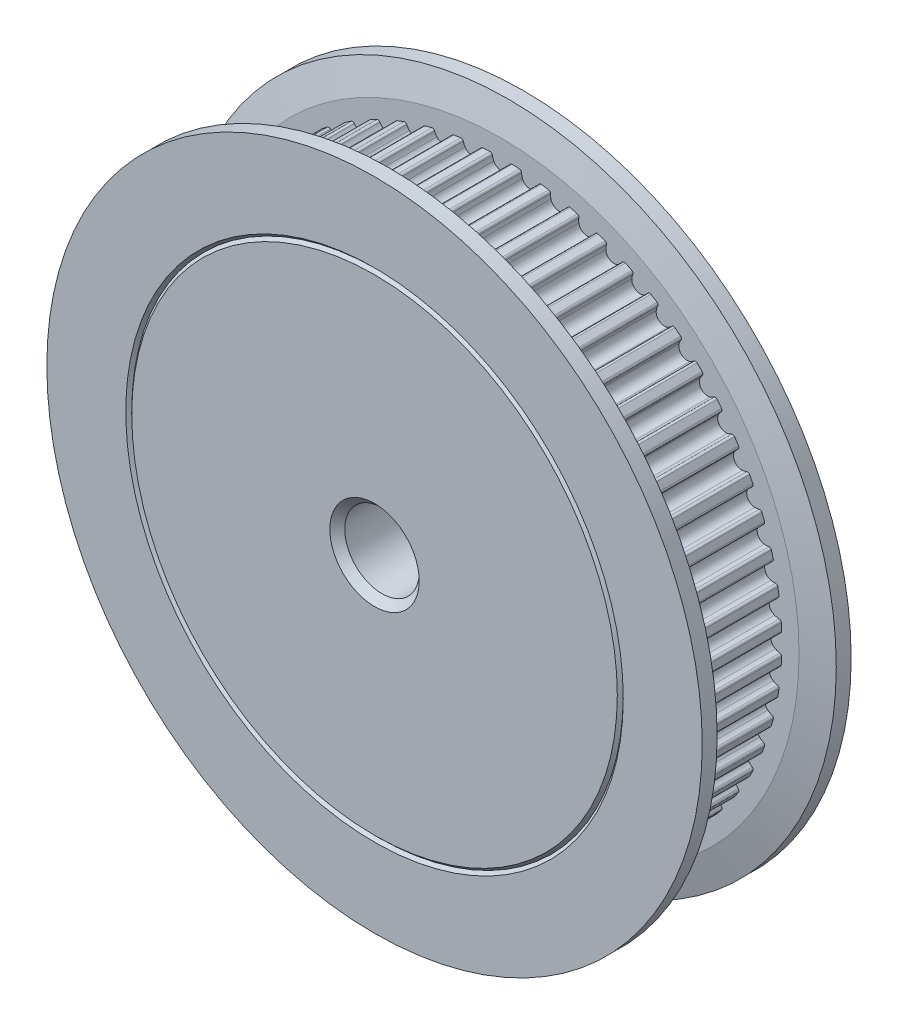
from build123d import *

# Parameters (mm, degrees)
CHAMFER_1_SIZE      = 0.5
CHAMFER_2_SIZE      = 2
CHAMFER_2_SIZE2     = 0.5
CHAMFER_3_SIZE      = 0.5
CHAMFER_3_SIZE2     = 2
CUT_EXTRUDE_START   = -1.5
CUT_EXTRUDE_4_DEPTH = 7
FILLET_1_R          = 0.15


with BuildPart() as part:
    # Эскиз2 → Повернуть1 (revolve)
    with BuildSketch(Plane(origin=(0, 0, 0), x_dir=(0, 0, -1), z_dir=(1, 0, 0)), mode=Mode.PRIVATE) as revolve_1_sk:
        Polygon((0, 16.3), (0, 2.5), (16, 2.5), (16, 12.5), (10, 12.5), (10, 16.3), (9.8, 16.5), (10, 16.7), (10, 22), (8.5, 22), (8.5, 18.85), (1.5, 18.85), (1.5, 22), (0, 22), (0, 16.7), (0.2, 16.5), align=None)
    revolve(revolve_1_sk.sketch.rotate(Axis((0, 0, 14.55226209), (0, 0, -1)), 90), axis=Axis((0, 0, 14.55226209), (0, 0, -1)))

    # Фаска1
    chamfer_1_edges = [part.edges().sort_by_distance(p)[0] for p in [
        (-12.5, 0, -10),
        (-12.5, 0, -16),
        (-2.5, 0, -16),
        (-2.5, 0, 0),
    ]]
    chamfer(chamfer_1_edges, length=CHAMFER_1_SIZE)

    # Фаска2
    chamfer_2_edges = [part.edges().sort_by_distance(p)[0] for p in [
        (-22, 0, -1.5),
    ]]
    chamfer_2_side = [part.faces().sort_by_distance(p)[0] for p in [
        (-19.472253967, 0, -1.5),
    ]]
    chamfer(chamfer_2_edges, length=CHAMFER_2_SIZE, length2=CHAMFER_2_SIZE2, reference=chamfer_2_side[0])

    # Фаска3
    chamfer_3_edges = [part.edges().sort_by_distance(p)[0] for p in [
        (-22, 0, -8.5),
    ]]
    chamfer_3_side = [part.faces().sort_by_distance(p)[0] for p in [
        (-22, 0, -9.25),
    ]]
    chamfer(chamfer_3_edges, length=CHAMFER_3_SIZE, length2=CHAMFER_3_SIZE2, reference=chamfer_3_side[0])

    # Эскиз3 → Вырез-Вытянуть4 (cut)
    with BuildSketch(Plane.XY.offset(CUT_EXTRUDE_START)):
        with BuildLine():
            ThreePointArc((-0.498876404, 18.411797753), (0, 18.1), (0.498876404, 18.411797753))
            ThreePointArc((0.498876404, 18.411797753), (0.573306366, 18.620490267), (0.599954397, 18.840449961))
            ThreePointArc((0.599954397, 18.840449961), (0, 18.85), (-0.599954397, 18.840449961))
            ThreePointArc((-0.599954397, 18.840449961), (-0.573306366, 18.620490267), (-0.498876404, 18.411797753))
        make_face()
        with BuildLine():
            ThreePointArc((1.372695497, 18.799952316), (1.970361533, 18.746737728), (2.566031066, 18.674527693))
            ThreePointArc((2.566031066, 18.674527693), (2.516536967, 18.458558439), (2.420700432, 18.258789214))
            ThreePointArc((2.420700432, 18.258789214), (1.891965185, 18.000846306), (1.428413418, 18.363082782))
            ThreePointArc((1.428413418, 18.363082782), (1.376205499, 18.578412106), (1.372695497, 18.799952316))
        make_face()
        with BuildLine():
            ThreePointArc((3.330305853, 18.553478459), (3.919135372, 18.438082274), (4.503993761, 18.304003393))
            ThreePointArc((4.503993761, 18.304003393), (4.432195862, 18.094390783), (4.31600276, 17.90573356))
            ThreePointArc((4.31600276, 17.90573356), (3.763201604, 17.704471573), (3.340053244, 18.113178034))
            ThreePointArc((3.340053244, 18.113178034), (3.310639369, 18.332784975), (3.330305853, 18.553478459))
        make_face()
        with BuildLine():
            ThreePointArc((5.25142868, 18.10372881), (5.824970344, 17.927415332), (6.392609759, 17.7329366))
            ThreePointArc((6.392609759, 17.7329366), (6.299294691, 17.531977195), (6.164018058, 17.356498942))
            ThreePointArc((6.164018058, 17.356498942), (5.593207598, 17.214122945), (5.215098747, 17.664821517))
            ThreePointArc((5.215098747, 17.664821517), (5.208801181, 17.886300015), (5.25142868, 18.10372881))
        make_face()
        with BuildLine():
            ThreePointArc((7.115015757, 17.455630919), (7.666985722, 17.220331877), (8.211186986, 16.967584044))
            ThreePointArc((8.211186986, 16.967584044), (8.09737713, 16.777479595), (7.944499084, 16.61710289))
            ThreePointArc((7.944499084, 16.61710289), (7.36193324, 16.535172783), (7.033006538, 17.022925518))
            ThreePointArc((7.033006538, 17.022925518), (7.049894277, 17.243849009), (7.115015757, 17.455630919))
        make_face()
        with BuildLine():
            ThreePointArc((8.900649231, 16.616285483), (9.425, 16.324578861), (9.93980073, 16.016331086))
            ThreePointArc((9.93980073, 16.016331086), (9.806743011, 15.839164419), (9.637938516, 15.695646381))
            ThreePointArc((9.637938516, 15.695646381), (9.05, 15.675059808), (8.773859237, 16.194522786))
            ThreePointArc((8.773859237, 16.194522786), (8.813747256, 16.412470785), (8.900649231, 16.616285483))
        make_face()
        with BuildLine():
            ThreePointArc((10.58876533, 15.594888547), (11.079752006, 15.249970344), (11.559511937, 14.889599853))
            ThreePointArc((11.559511937, 14.889599853), (11.408664162, 14.727312042), (11.225782677, 14.602225086))
            ThreePointArc((11.225782677, 14.602225086), (10.638913066, 14.643207598), (10.418583698, 15.188689472))
            ThreePointArc((10.418583698, 15.188689472), (10.481034976, 15.401274096), (10.58876533, 15.594888547))
        make_face()
        with BuildLine():
            ThreePointArc((12.1608687, 14.402630748), (12.61311193, 14.00827996), (13.052574712, 13.599735048))
            ThreePointArc((13.052574712, 13.599735048), (12.885589602, 13.454104153), (12.690634813, 13.348818757))
            ThreePointArc((12.690634813, 13.348818757), (12.111263975, 13.450921341), (11.949159976, 14.016445699))
            ThreePointArc((11.949159976, 14.016445699), (12.033490283, 14.221337826), (12.1608687, 14.402630748))
        make_face()
        with BuildLine():
            ThreePointArc((13.599735048, 13.052574712), (14.00827996, 12.61311193), (14.402630748, 12.1608687))
            ThreePointArc((14.402630748, 12.1608687), (14.221337826, 12.033490283), (14.016445699, 11.949159976))
            ThreePointArc((14.016445699, 11.949159976), (13.450921341, 12.111263975), (13.348818757, 12.690634813))
            ThreePointArc((13.348818757, 12.690634813), (13.454104153, 12.885589602), (13.599735048, 13.052574712))
        make_face()
        with BuildLine():
            ThreePointArc((14.889599853, 11.559511937), (15.249970344, 11.079752006), (15.594888547, 10.58876533))
            ThreePointArc((15.594888547, 10.58876533), (15.401274096, 10.481034976), (15.188689472, 10.418583698))
            ThreePointArc((15.188689472, 10.418583698), (14.643207598, 10.638913066), (14.602225086, 11.225782677))
            ThreePointArc((14.602225086, 11.225782677), (14.727312042, 11.408664162), (14.889599853, 11.559511937))
        make_face()
        with BuildLine():
            ThreePointArc((16.016331086, 9.93980073), (16.324578861, 9.425), (16.616285483, 8.900649231))
            ThreePointArc((16.616285483, 8.900649231), (16.412470785, 8.813747256), (16.194522786, 8.773859237))
            ThreePointArc((16.194522786, 8.773859237), (15.675059808, 9.05), (15.695646381, 9.637938516))
            ThreePointArc((15.695646381, 9.637938516), (15.839164419, 9.806743011), (16.016331086, 9.93980073))
        make_face()
        with BuildLine():
            ThreePointArc((16.967584044, 8.211186986), (17.220331877, 7.666985722), (17.455630919, 7.115015757))
            ThreePointArc((17.455630919, 7.115015757), (17.243849009, 7.049894277), (17.022925518, 7.033006538))
            ThreePointArc((17.022925518, 7.033006538), (16.535172783, 7.36193324), (16.61710289, 7.944499084))
            ThreePointArc((16.61710289, 7.944499084), (16.777479595, 8.09737713), (16.967584044, 8.211186986))
        make_face()
        with BuildLine():
            ThreePointArc((17.7329366, 6.392609759), (17.927415332, 5.824970344), (18.10372881, 5.25142868))
            ThreePointArc((18.10372881, 5.25142868), (17.886300015, 5.208801181), (17.664821517, 5.215098747))
            ThreePointArc((17.664821517, 5.215098747), (17.214122945, 5.593207598), (17.356498942, 6.164018058))
            ThreePointArc((17.356498942, 6.164018058), (17.531977195, 6.299294691), (17.7329366, 6.392609759))
        make_face()
        with BuildLine():
            ThreePointArc((18.304003393, 4.503993761), (18.438082274, 3.919135372), (18.553478459, 3.330305853))
            ThreePointArc((18.553478459, 3.330305853), (18.332784975, 3.310639369), (18.113178034, 3.340053244))
            ThreePointArc((18.113178034, 3.340053244), (17.704471573, 3.763201604), (17.90573356, 4.31600276))
            ThreePointArc((17.90573356, 4.31600276), (18.094390783, 4.432195862), (18.304003393, 4.503993761))
        make_face()
        with BuildLine():
            ThreePointArc((18.674527693, 2.566031066), (18.746737728, 1.970361533), (18.799952316, 1.372695497))
            ThreePointArc((18.799952316, 1.372695497), (18.578412106, 1.376205499), (18.363082782, 1.428413418))
            ThreePointArc((18.363082782, 1.428413418), (18.000846306, 1.891965185), (18.258789214, 2.420700432))
            ThreePointArc((18.258789214, 2.420700432), (18.458558439, 2.516536967), (18.674527693, 2.566031066))
        make_face()
        with BuildLine():
            ThreePointArc((18.840449961, 0.599954397), (18.85, 0), (18.840449961, -0.599954397))
            ThreePointArc((18.840449961, -0.599954397), (18.620490267, -0.573306366), (18.411797753, -0.498876404))
            ThreePointArc((18.411797753, -0.498876404), (18.1, 0), (18.411797753, 0.498876404))
            ThreePointArc((18.411797753, 0.498876404), (18.620490267, 0.573306366), (18.840449961, 0.599954397))
        make_face()
        with BuildLine():
            ThreePointArc((18.799952316, -1.372695497), (18.746737728, -1.970361533), (18.674527693, -2.566031066))
            ThreePointArc((18.674527693, -2.566031066), (18.458558439, -2.516536967), (18.258789214, -2.420700432))
            ThreePointArc((18.258789214, -2.420700432), (18.000846306, -1.891965185), (18.363082782, -1.428413418))
            ThreePointArc((18.363082782, -1.428413418), (18.578412106, -1.376205499), (18.799952316, -1.372695497))
        make_face()
        with BuildLine():
            ThreePointArc((18.553478459, -3.330305853), (18.438082274, -3.919135372), (18.304003393, -4.503993761))
            ThreePointArc((18.304003393, -4.503993761), (18.094390783, -4.432195862), (17.90573356, -4.31600276))
            ThreePointArc((17.90573356, -4.31600276), (17.704471573, -3.763201604), (18.113178034, -3.340053244))
            ThreePointArc((18.113178034, -3.340053244), (18.332784975, -3.310639369), (18.553478459, -3.330305853))
        make_face()
        with BuildLine():
            ThreePointArc((18.10372881, -5.25142868), (17.927415332, -5.824970344), (17.7329366, -6.392609759))
            ThreePointArc((17.7329366, -6.392609759), (17.531977195, -6.299294691), (17.356498942, -6.164018058))
            ThreePointArc((17.356498942, -6.164018058), (17.214122945, -5.593207598), (17.664821517, -5.215098747))
            ThreePointArc((17.664821517, -5.215098747), (17.886300015, -5.208801181), (18.10372881, -5.25142868))
        make_face()
        with BuildLine():
            ThreePointArc((17.455630919, -7.115015757), (17.220331877, -7.666985722), (16.967584044, -8.211186986))
            ThreePointArc((16.967584044, -8.211186986), (16.777479595, -8.09737713), (16.61710289, -7.944499084))
            ThreePointArc((16.61710289, -7.944499084), (16.535172783, -7.36193324), (17.022925518, -7.033006538))
            ThreePointArc((17.022925518, -7.033006538), (17.243849009, -7.049894277), (17.455630919, -7.115015757))
        make_face()
        with BuildLine():
            ThreePointArc((16.616285483, -8.900649231), (16.324578861, -9.425), (16.016331086, -9.93980073))
            ThreePointArc((16.016331086, -9.93980073), (15.839164419, -9.806743011), (15.695646381, -9.637938516))
            ThreePointArc((15.695646381, -9.637938516), (15.675059808, -9.05), (16.194522786, -8.773859237))
            ThreePointArc((16.194522786, -8.773859237), (16.412470785, -8.813747256), (16.616285483, -8.900649231))
        make_face()
        with BuildLine():
            ThreePointArc((15.594888547, -10.58876533), (15.249970344, -11.079752006), (14.889599853, -11.559511937))
            ThreePointArc((14.889599853, -11.559511937), (14.727312042, -11.408664162), (14.602225086, -11.225782677))
            ThreePointArc((14.602225086, -11.225782677), (14.643207598, -10.638913066), (15.188689472, -10.418583698))
            ThreePointArc((15.188689472, -10.418583698), (15.401274096, -10.481034976), (15.594888547, -10.58876533))
        make_face()
        with BuildLine():
            ThreePointArc((14.402630748, -12.1608687), (14.00827996, -12.61311193), (13.599735048, -13.052574712))
            ThreePointArc((13.599735048, -13.052574712), (13.454104153, -12.885589602), (13.348818757, -12.690634813))
            ThreePointArc((13.348818757, -12.690634813), (13.450921341, -12.111263975), (14.016445699, -11.949159976))
            ThreePointArc((14.016445699, -11.949159976), (14.221337826, -12.033490283), (14.402630748, -12.1608687))
        make_face()
        with BuildLine():
            ThreePointArc((13.052574712, -13.599735048), (12.61311193, -14.00827996), (12.1608687, -14.402630748))
            ThreePointArc((12.1608687, -14.402630748), (12.033490283, -14.221337826), (11.949159976, -14.016445699))
            ThreePointArc((11.949159976, -14.016445699), (12.111263975, -13.450921341), (12.690634813, -13.348818757))
            ThreePointArc((12.690634813, -13.348818757), (12.885589602, -13.454104153), (13.052574712, -13.599735048))
        make_face()
        with BuildLine():
            ThreePointArc((11.559511937, -14.889599853), (11.079752006, -15.249970344), (10.58876533, -15.594888547))
            ThreePointArc((10.58876533, -15.594888547), (10.481034976, -15.401274096), (10.418583698, -15.188689472))
            ThreePointArc((10.418583698, -15.188689472), (10.638913066, -14.643207598), (11.225782677, -14.602225086))
            ThreePointArc((11.225782677, -14.602225086), (11.408664162, -14.727312042), (11.559511937, -14.889599853))
        make_face()
        with BuildLine():
            ThreePointArc((9.93980073, -16.016331086), (9.425, -16.324578861), (8.900649231, -16.616285483))
            ThreePointArc((8.900649231, -16.616285483), (8.813747256, -16.412470785), (8.773859237, -16.194522786))
            ThreePointArc((8.773859237, -16.194522786), (9.05, -15.675059808), (9.637938516, -15.695646381))
            ThreePointArc((9.637938516, -15.695646381), (9.806743011, -15.839164419), (9.93980073, -16.016331086))
        make_face()
        with BuildLine():
            ThreePointArc((8.211186986, -16.967584044), (7.666985722, -17.220331877), (7.115015757, -17.455630919))
            ThreePointArc((7.115015757, -17.455630919), (7.049894277, -17.243849009), (7.033006538, -17.022925518))
            ThreePointArc((7.033006538, -17.022925518), (7.36193324, -16.535172783), (7.944499084, -16.61710289))
            ThreePointArc((7.944499084, -16.61710289), (8.09737713, -16.777479595), (8.211186986, -16.967584044))
        make_face()
        with BuildLine():
            ThreePointArc((6.392609759, -17.7329366), (5.824970344, -17.927415332), (5.25142868, -18.10372881))
            ThreePointArc((5.25142868, -18.10372881), (5.208801181, -17.886300015), (5.215098747, -17.664821517))
            ThreePointArc((5.215098747, -17.664821517), (5.593207598, -17.214122945), (6.164018058, -17.356498942))
            ThreePointArc((6.164018058, -17.356498942), (6.299294691, -17.531977195), (6.392609759, -17.7329366))
        make_face()
        with BuildLine():
            ThreePointArc((4.503993761, -18.304003393), (3.919135372, -18.438082274), (3.330305853, -18.553478459))
            ThreePointArc((3.330305853, -18.553478459), (3.310639369, -18.332784975), (3.340053244, -18.113178034))
            ThreePointArc((3.340053244, -18.113178034), (3.763201604, -17.704471573), (4.31600276, -17.90573356))
            ThreePointArc((4.31600276, -17.90573356), (4.432195862, -18.094390783), (4.503993761, -18.304003393))
        make_face()
        with BuildLine():
            ThreePointArc((2.566031066, -18.674527693), (1.970361533, -18.746737728), (1.372695497, -18.799952316))
            ThreePointArc((1.372695497, -18.799952316), (1.376205499, -18.578412106), (1.428413418, -18.363082782))
            ThreePointArc((1.428413418, -18.363082782), (1.891965185, -18.000846306), (2.420700432, -18.258789214))
            ThreePointArc((2.420700432, -18.258789214), (2.516536967, -18.458558439), (2.566031066, -18.674527693))
        make_face()
        with BuildLine():
            ThreePointArc((0.599954397, -18.840449961), (0, -18.85), (-0.599954397, -18.840449961))
            ThreePointArc((-0.599954397, -18.840449961), (-0.573306366, -18.620490267), (-0.498876404, -18.411797753))
            ThreePointArc((-0.498876404, -18.411797753), (0, -18.1), (0.498876404, -18.411797753))
            ThreePointArc((0.498876404, -18.411797753), (0.573306366, -18.620490267), (0.599954397, -18.840449961))
        make_face()
        with BuildLine():
            ThreePointArc((-1.372695497, -18.799952316), (-1.970361533, -18.746737728), (-2.566031066, -18.674527693))
            ThreePointArc((-2.566031066, -18.674527693), (-2.516536967, -18.458558439), (-2.420700432, -18.258789214))
            ThreePointArc((-2.420700432, -18.258789214), (-1.891965185, -18.000846306), (-1.428413418, -18.363082782))
            ThreePointArc((-1.428413418, -18.363082782), (-1.376205499, -18.578412106), (-1.372695497, -18.799952316))
        make_face()
        with BuildLine():
            ThreePointArc((-3.330305853, -18.553478459), (-3.919135372, -18.438082274), (-4.503993761, -18.304003393))
            ThreePointArc((-4.503993761, -18.304003393), (-4.432195862, -18.094390783), (-4.31600276, -17.90573356))
            ThreePointArc((-4.31600276, -17.90573356), (-3.763201604, -17.704471573), (-3.340053244, -18.113178034))
            ThreePointArc((-3.340053244, -18.113178034), (-3.310639369, -18.332784975), (-3.330305853, -18.553478459))
        make_face()
        with BuildLine():
            ThreePointArc((-5.25142868, -18.10372881), (-5.824970344, -17.927415332), (-6.392609759, -17.7329366))
            ThreePointArc((-6.392609759, -17.7329366), (-6.299294691, -17.531977195), (-6.164018058, -17.356498942))
            ThreePointArc((-6.164018058, -17.356498942), (-5.593207598, -17.214122945), (-5.215098747, -17.664821517))
            ThreePointArc((-5.215098747, -17.664821517), (-5.208801181, -17.886300015), (-5.25142868, -18.10372881))
        make_face()
        with BuildLine():
            ThreePointArc((-7.115015757, -17.455630919), (-7.666985722, -17.220331877), (-8.211186986, -16.967584044))
            ThreePointArc((-8.211186986, -16.967584044), (-8.09737713, -16.777479595), (-7.944499084, -16.61710289))
            ThreePointArc((-7.944499084, -16.61710289), (-7.36193324, -16.535172783), (-7.033006538, -17.022925518))
            ThreePointArc((-7.033006538, -17.022925518), (-7.049894277, -17.243849009), (-7.115015757, -17.455630919))
        make_face()
        with BuildLine():
            ThreePointArc((-8.900649231, -16.616285483), (-9.425, -16.324578861), (-9.93980073, -16.016331086))
            ThreePointArc((-9.93980073, -16.016331086), (-9.806743011, -15.839164419), (-9.637938516, -15.695646381))
            ThreePointArc((-9.637938516, -15.695646381), (-9.05, -15.675059808), (-8.773859237, -16.194522786))
            ThreePointArc((-8.773859237, -16.194522786), (-8.813747256, -16.412470785), (-8.900649231, -16.616285483))
        make_face()
        with BuildLine():
            ThreePointArc((-10.58876533, -15.594888547), (-11.079752006, -15.249970344), (-11.559511937, -14.889599853))
            ThreePointArc((-11.559511937, -14.889599853), (-11.408664162, -14.727312042), (-11.225782677, -14.602225086))
            ThreePointArc((-11.225782677, -14.602225086), (-10.638913066, -14.643207598), (-10.418583698, -15.188689472))
            ThreePointArc((-10.418583698, -15.188689472), (-10.481034976, -15.401274096), (-10.58876533, -15.594888547))
        make_face()
        with BuildLine():
            ThreePointArc((-12.1608687, -14.402630748), (-12.61311193, -14.00827996), (-13.052574712, -13.599735048))
            ThreePointArc((-13.052574712, -13.599735048), (-12.885589602, -13.454104153), (-12.690634813, -13.348818757))
            ThreePointArc((-12.690634813, -13.348818757), (-12.111263975, -13.450921341), (-11.949159976, -14.016445699))
            ThreePointArc((-11.949159976, -14.016445699), (-12.033490283, -14.221337826), (-12.1608687, -14.402630748))
        make_face()
        with BuildLine():
            ThreePointArc((-13.599735048, -13.052574712), (-14.00827996, -12.61311193), (-14.402630748, -12.1608687))
            ThreePointArc((-14.402630748, -12.1608687), (-14.221337826, -12.033490283), (-14.016445699, -11.949159976))
            ThreePointArc((-14.016445699, -11.949159976), (-13.450921341, -12.111263975), (-13.348818757, -12.690634813))
            ThreePointArc((-13.348818757, -12.690634813), (-13.454104153, -12.885589602), (-13.599735048, -13.052574712))
        make_face()
        with BuildLine():
            ThreePointArc((-14.889599853, -11.559511937), (-15.249970344, -11.079752006), (-15.594888547, -10.58876533))
            ThreePointArc((-15.594888547, -10.58876533), (-15.401274096, -10.481034976), (-15.188689472, -10.418583698))
            ThreePointArc((-15.188689472, -10.418583698), (-14.643207598, -10.638913066), (-14.602225086, -11.225782677))
            ThreePointArc((-14.602225086, -11.225782677), (-14.727312042, -11.408664162), (-14.889599853, -11.559511937))
        make_face()
        with BuildLine():
            ThreePointArc((-16.016331086, -9.93980073), (-16.324578861, -9.425), (-16.616285483, -8.900649231))
            ThreePointArc((-16.616285483, -8.900649231), (-16.412470785, -8.813747256), (-16.194522786, -8.773859237))
            ThreePointArc((-16.194522786, -8.773859237), (-15.675059808, -9.05), (-15.695646381, -9.637938516))
            ThreePointArc((-15.695646381, -9.637938516), (-15.839164419, -9.806743011), (-16.016331086, -9.93980073))
        make_face()
        with BuildLine():
            ThreePointArc((-16.967584044, -8.211186986), (-17.220331877, -7.666985722), (-17.455630919, -7.115015757))
            ThreePointArc((-17.455630919, -7.115015757), (-17.243849009, -7.049894277), (-17.022925518, -7.033006538))
            ThreePointArc((-17.022925518, -7.033006538), (-16.535172783, -7.36193324), (-16.61710289, -7.944499084))
            ThreePointArc((-16.61710289, -7.944499084), (-16.777479595, -8.09737713), (-16.967584044, -8.211186986))
        make_face()
        with BuildLine():
            ThreePointArc((-17.7329366, -6.392609759), (-17.927415332, -5.824970344), (-18.10372881, -5.25142868))
            ThreePointArc((-18.10372881, -5.25142868), (-17.886300015, -5.208801181), (-17.664821517, -5.215098747))
            ThreePointArc((-17.664821517, -5.215098747), (-17.214122945, -5.593207598), (-17.356498942, -6.164018058))
            ThreePointArc((-17.356498942, -6.164018058), (-17.531977195, -6.299294691), (-17.7329366, -6.392609759))
        make_face()
        with BuildLine():
            ThreePointArc((-18.304003393, -4.503993761), (-18.438082274, -3.919135372), (-18.553478459, -3.330305853))
            ThreePointArc((-18.553478459, -3.330305853), (-18.332784975, -3.310639369), (-18.113178034, -3.340053244))
            ThreePointArc((-18.113178034, -3.340053244), (-17.704471573, -3.763201604), (-17.90573356, -4.31600276))
            ThreePointArc((-17.90573356, -4.31600276), (-18.094390783, -4.432195862), (-18.304003393, -4.503993761))
        make_face()
        with BuildLine():
            ThreePointArc((-18.674527693, -2.566031066), (-18.746737728, -1.970361533), (-18.799952316, -1.372695497))
            ThreePointArc((-18.799952316, -1.372695497), (-18.578412106, -1.376205499), (-18.363082782, -1.428413418))
            ThreePointArc((-18.363082782, -1.428413418), (-18.000846306, -1.891965185), (-18.258789214, -2.420700432))
            ThreePointArc((-18.258789214, -2.420700432), (-18.458558439, -2.516536967), (-18.674527693, -2.566031066))
        make_face()
        with BuildLine():
            ThreePointArc((-18.840449961, -0.599954397), (-18.85, 0), (-18.840449961, 0.599954397))
            ThreePointArc((-18.840449961, 0.599954397), (-18.620490267, 0.573306366), (-18.411797753, 0.498876404))
            ThreePointArc((-18.411797753, 0.498876404), (-18.1, 0), (-18.411797753, -0.498876404))
            ThreePointArc((-18.411797753, -0.498876404), (-18.620490267, -0.573306366), (-18.840449961, -0.599954397))
        make_face()
        with BuildLine():
            ThreePointArc((-18.799952316, 1.372695497), (-18.746737728, 1.970361533), (-18.674527693, 2.566031066))
            ThreePointArc((-18.674527693, 2.566031066), (-18.458558439, 2.516536967), (-18.258789214, 2.420700432))
            ThreePointArc((-18.258789214, 2.420700432), (-18.000846306, 1.891965185), (-18.363082782, 1.428413418))
            ThreePointArc((-18.363082782, 1.428413418), (-18.578412106, 1.376205499), (-18.799952316, 1.372695497))
        make_face()
        with BuildLine():
            ThreePointArc((-18.553478459, 3.330305853), (-18.438082274, 3.919135372), (-18.304003393, 4.503993761))
            ThreePointArc((-18.304003393, 4.503993761), (-18.094390783, 4.432195862), (-17.90573356, 4.31600276))
            ThreePointArc((-17.90573356, 4.31600276), (-17.704471573, 3.763201604), (-18.113178034, 3.340053244))
            ThreePointArc((-18.113178034, 3.340053244), (-18.332784975, 3.310639369), (-18.553478459, 3.330305853))
        make_face()
        with BuildLine():
            ThreePointArc((-18.10372881, 5.25142868), (-17.927415332, 5.824970344), (-17.7329366, 6.392609759))
            ThreePointArc((-17.7329366, 6.392609759), (-17.531977195, 6.299294691), (-17.356498942, 6.164018058))
            ThreePointArc((-17.356498942, 6.164018058), (-17.214122945, 5.593207598), (-17.664821517, 5.215098747))
            ThreePointArc((-17.664821517, 5.215098747), (-17.886300015, 5.208801181), (-18.10372881, 5.25142868))
        make_face()
        with BuildLine():
            ThreePointArc((-17.455630919, 7.115015757), (-17.220331877, 7.666985722), (-16.967584044, 8.211186986))
            ThreePointArc((-16.967584044, 8.211186986), (-16.777479595, 8.09737713), (-16.61710289, 7.944499084))
            ThreePointArc((-16.61710289, 7.944499084), (-16.535172783, 7.36193324), (-17.022925518, 7.033006538))
            ThreePointArc((-17.022925518, 7.033006538), (-17.243849009, 7.049894277), (-17.455630919, 7.115015757))
        make_face()
        with BuildLine():
            ThreePointArc((-16.616285483, 8.900649231), (-16.324578861, 9.425), (-16.016331086, 9.93980073))
            ThreePointArc((-16.016331086, 9.93980073), (-15.839164419, 9.806743011), (-15.695646381, 9.637938516))
            ThreePointArc((-15.695646381, 9.637938516), (-15.675059808, 9.05), (-16.194522786, 8.773859237))
            ThreePointArc((-16.194522786, 8.773859237), (-16.412470785, 8.813747256), (-16.616285483, 8.900649231))
        make_face()
        with BuildLine():
            ThreePointArc((-15.594888547, 10.58876533), (-15.249970344, 11.079752006), (-14.889599853, 11.559511937))
            ThreePointArc((-14.889599853, 11.559511937), (-14.727312042, 11.408664162), (-14.602225086, 11.225782677))
            ThreePointArc((-14.602225086, 11.225782677), (-14.643207598, 10.638913066), (-15.188689472, 10.418583698))
            ThreePointArc((-15.188689472, 10.418583698), (-15.401274096, 10.481034976), (-15.594888547, 10.58876533))
        make_face()
        with BuildLine():
            ThreePointArc((-14.402630748, 12.1608687), (-14.00827996, 12.61311193), (-13.599735048, 13.052574712))
            ThreePointArc((-13.599735048, 13.052574712), (-13.454104153, 12.885589602), (-13.348818757, 12.690634813))
            ThreePointArc((-13.348818757, 12.690634813), (-13.450921341, 12.111263975), (-14.016445699, 11.949159976))
            ThreePointArc((-14.016445699, 11.949159976), (-14.221337826, 12.033490283), (-14.402630748, 12.1608687))
        make_face()
        with BuildLine():
            ThreePointArc((-13.052574712, 13.599735048), (-12.61311193, 14.00827996), (-12.1608687, 14.402630748))
            ThreePointArc((-12.1608687, 14.402630748), (-12.033490283, 14.221337826), (-11.949159976, 14.016445699))
            ThreePointArc((-11.949159976, 14.016445699), (-12.111263975, 13.450921341), (-12.690634813, 13.348818757))
            ThreePointArc((-12.690634813, 13.348818757), (-12.885589602, 13.454104153), (-13.052574712, 13.599735048))
        make_face()
        with BuildLine():
            ThreePointArc((-11.559511937, 14.889599853), (-11.079752006, 15.249970344), (-10.58876533, 15.594888547))
            ThreePointArc((-10.58876533, 15.594888547), (-10.481034976, 15.401274096), (-10.418583698, 15.188689472))
            ThreePointArc((-10.418583698, 15.188689472), (-10.638913066, 14.643207598), (-11.225782677, 14.602225086))
            ThreePointArc((-11.225782677, 14.602225086), (-11.408664162, 14.727312042), (-11.559511937, 14.889599853))
        make_face()
        with BuildLine():
            ThreePointArc((-9.93980073, 16.016331086), (-9.425, 16.324578861), (-8.900649231, 16.616285483))
            ThreePointArc((-8.900649231, 16.616285483), (-8.813747256, 16.412470785), (-8.773859237, 16.194522786))
            ThreePointArc((-8.773859237, 16.194522786), (-9.05, 15.675059808), (-9.637938516, 15.695646381))
            ThreePointArc((-9.637938516, 15.695646381), (-9.806743011, 15.839164419), (-9.93980073, 16.016331086))
        make_face()
        with BuildLine():
            ThreePointArc((-8.211186986, 16.967584044), (-7.666985722, 17.220331877), (-7.115015757, 17.455630919))
            ThreePointArc((-7.115015757, 17.455630919), (-7.049894277, 17.243849009), (-7.033006538, 17.022925518))
            ThreePointArc((-7.033006538, 17.022925518), (-7.36193324, 16.535172783), (-7.944499084, 16.61710289))
            ThreePointArc((-7.944499084, 16.61710289), (-8.09737713, 16.777479595), (-8.211186986, 16.967584044))
        make_face()
        with BuildLine():
            ThreePointArc((-6.392609759, 17.7329366), (-5.824970344, 17.927415332), (-5.25142868, 18.10372881))
            ThreePointArc((-5.25142868, 18.10372881), (-5.208801181, 17.886300015), (-5.215098747, 17.664821517))
            ThreePointArc((-5.215098747, 17.664821517), (-5.593207598, 17.214122945), (-6.164018058, 17.356498942))
            ThreePointArc((-6.164018058, 17.356498942), (-6.299294691, 17.531977195), (-6.392609759, 17.7329366))
        make_face()
        with BuildLine():
            ThreePointArc((-4.503993761, 18.304003393), (-3.919135372, 18.438082274), (-3.330305853, 18.553478459))
            ThreePointArc((-3.330305853, 18.553478459), (-3.310639369, 18.332784975), (-3.340053244, 18.113178034))
            ThreePointArc((-3.340053244, 18.113178034), (-3.763201604, 17.704471573), (-4.31600276, 17.90573356))
            ThreePointArc((-4.31600276, 17.90573356), (-4.432195862, 18.094390783), (-4.503993761, 18.304003393))
        make_face()
        with BuildLine():
            ThreePointArc((-2.566031066, 18.674527693), (-1.970361533, 18.746737728), (-1.372695497, 18.799952316))
            ThreePointArc((-1.372695497, 18.799952316), (-1.376205499, 18.578412106), (-1.428413418, 18.363082782))
            ThreePointArc((-1.428413418, 18.363082782), (-1.891965185, 18.000846306), (-2.420700432, 18.258789214))
            ThreePointArc((-2.420700432, 18.258789214), (-2.516536967, 18.458558439), (-2.566031066, 18.674527693))
        make_face()
    extrude(amount=-CUT_EXTRUDE_4_DEPTH, mode=Mode.SUBTRACT)

    # Скругление1
    fillet_1_edges = [part.edges().sort_by_distance(p)[0] for p in [
        (7.115015757, 17.455630919, -5),
        (8.211186986, 16.967584044, -5),
        (8.900649231, 16.616285483, -5),
        (9.93980073, 16.016331086, -5),
        (10.58876533, 15.594888547, -5),
        (11.559511937, 14.889599853, -5),
        (12.1608687, 14.402630748, -5),
        (13.052574712, 13.599735048, -5),
        (13.599735048, 13.052574712, -5),
        (14.402630748, 12.1608687, -5),
        (14.889599853, 11.559511937, -5),
        (15.594888547, 10.58876533, -5),
        (16.016331086, 9.93980073, -5),
        (16.616285483, 8.900649231, -5),
        (16.967584044, 8.211186986, -5),
        (17.455630919, 7.115015757, -5),
        (17.7329366, 6.392609759, -5),
        (18.10372881, 5.25142868, -5),
        (18.304003393, 4.503993761, -5),
        (18.553478459, 3.330305853, -5),
        (18.674527693, 2.566031066, -5),
        (18.799952316, 1.372695497, -5),
        (18.840449961, 0.599954397, -5),
        (18.840449961, -0.599954397, -5),
        (18.799952316, -1.372695497, -5),
        (18.674527693, -2.566031066, -5),
        (18.553478459, -3.330305853, -5),
        (18.304003393, -4.503993761, -5),
        (18.10372881, -5.25142868, -5),
        (17.7329366, -6.392609759, -5),
        (17.455630919, -7.115015757, -5),
        (16.967584044, -8.211186986, -5),
        (16.616285483, -8.900649231, -5),
        (16.016331086, -9.93980073, -5),
        (15.594888547, -10.58876533, -5),
        (14.889599853, -11.559511937, -5),
        (14.402630748, -12.1608687, -5),
        (13.599735048, -13.052574712, -5),
        (13.052574712, -13.599735048, -5),
        (12.1608687, -14.402630748, -5),
        (11.559511937, -14.889599853, -5),
        (10.58876533, -15.594888547, -5),
        (9.93980073, -16.016331086, -5),
        (8.900649231, -16.616285483, -5),
        (8.211186986, -16.967584044, -5),
        (7.115015757, -17.455630919, -5),
        (6.392609759, -17.7329366, -5),
        (5.25142868, -18.10372881, -5),
        (4.503993761, -18.304003393, -5),
        (3.330305853, -18.553478459, -5),
        (2.566031066, -18.674527693, -5),
        (1.372695497, -18.799952316, -5),
        (0.599954397, -18.840449961, -5),
        (-0.599954397, -18.840449961, -5),
        (-1.372695497, -18.799952316, -5),
        (-2.566031066, -18.674527693, -5),
        (-3.330305853, -18.553478459, -5),
        (-4.503993761, -18.304003393, -5),
        (-5.25142868, -18.10372881, -5),
        (-6.392609759, -17.7329366, -5),
        (-7.115015757, -17.455630919, -5),
        (-8.211186986, -16.967584044, -5),
        (-8.900649231, -16.616285483, -5),
        (-9.93980073, -16.016331086, -5),
        (-10.58876533, -15.594888547, -5),
        (-11.559511937, -14.889599853, -5),
        (-12.1608687, -14.402630748, -5),
        (-13.052574712, -13.599735048, -5),
        (-13.599735048, -13.052574712, -5),
        (-14.402630748, -12.1608687, -5),
        (-14.889599853, -11.559511937, -5),
        (-15.594888547, -10.58876533, -5),
        (-16.016331086, -9.93980073, -5),
        (-16.616285483, -8.900649231, -5),
        (-16.967584044, -8.211186986, -5),
        (-17.455630919, -7.115015757, -5),
        (-17.7329366, -6.392609759, -5),
        (-18.10372881, -5.25142868, -5),
        (-18.304003393, -4.503993761, -5),
        (-18.553478459, -3.330305853, -5),
        (-18.674527693, -2.566031066, -5),
        (-18.799952316, -1.372695497, -5),
        (-18.840449961, -0.599954397, -5),
        (-18.840449961, 0.599954397, -5),
        (-18.799952316, 1.372695497, -5),
        (-18.674527693, 2.566031066, -5),
        (-18.553478459, 3.330305853, -5),
        (-18.304003393, 4.503993761, -5),
        (-18.10372881, 5.25142868, -5),
        (-17.7329366, 6.392609759, -5),
        (-17.455630919, 7.115015757, -5),
        (-16.967584044, 8.211186986, -5),
        (-16.616285483, 8.900649231, -5),
        (-16.016331086, 9.93980073, -5),
        (-0.599954397, 18.840449961, -5),
        (0.599954397, 18.840449961, -5),
        (-15.594888547, 10.58876533, -5),
        (-14.889599853, 11.559511937, -5),
        (-14.402630748, 12.1608687, -5),
        (-13.599735048, 13.052574712, -5),
        (-13.052574712, 13.599735048, -5),
        (-12.1608687, 14.402630748, -5),
        (-11.559511937, 14.889599853, -5),
        (-10.58876533, 15.594888547, -5),
        (-9.93980073, 16.016331086, -5),
        (-8.900649231, 16.616285483, -5),
        (-8.211186986, 16.967584044, -5),
        (-7.115015757, 17.455630919, -5),
        (-6.392609759, 17.7329366, -5),
        (-5.25142868, 18.10372881, -5),
        (-4.503993761, 18.304003393, -5),
        (-3.330305853, 18.553478459, -5),
        (-2.566031066, 18.674527693, -5),
        (-1.372695497, 18.799952316, -5),
        (1.372695497, 18.799952316, -5),
        (2.566031066, 18.674527693, -5),
        (3.330305853, 18.553478459, -5),
        (4.503993761, 18.304003393, -5),
        (5.25142868, 18.10372881, -5),
        (6.392609759, 17.7329366, -5),
    ]]
    fillet(fillet_1_edges, radius=FILLET_1_R)


solid = part.part
